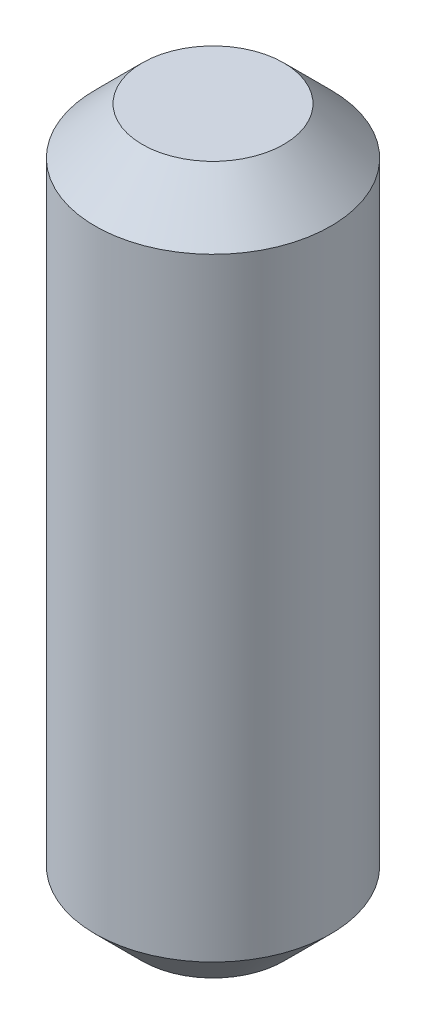
from build123d import *

# Parameters (mm, degrees)
SKETCH1_R           = 3.175
BOSS_EXTRUDE1_DEPTH = 19.05
CHAMFER1_SIZE       = 1.27


with BuildPart() as part:
    # Sketch1 → Boss-Extrude1 (new body)
    with BuildSketch(Plane(origin=(0, 0, 0), x_dir=(1, 0, 0), z_dir=(0, 1, 0))):
        Circle(SKETCH1_R)
    extrude(amount=BOSS_EXTRUDE1_DEPTH)

    # Chamfer1
    chamfer1_edges = [part.edges().sort_by_distance(p)[0] for p in [
        (-3.175, 0, 0),
        (-3.175, 19.05, 0),
    ]]
    chamfer(chamfer1_edges, length=CHAMFER1_SIZE)


solid = part.part
